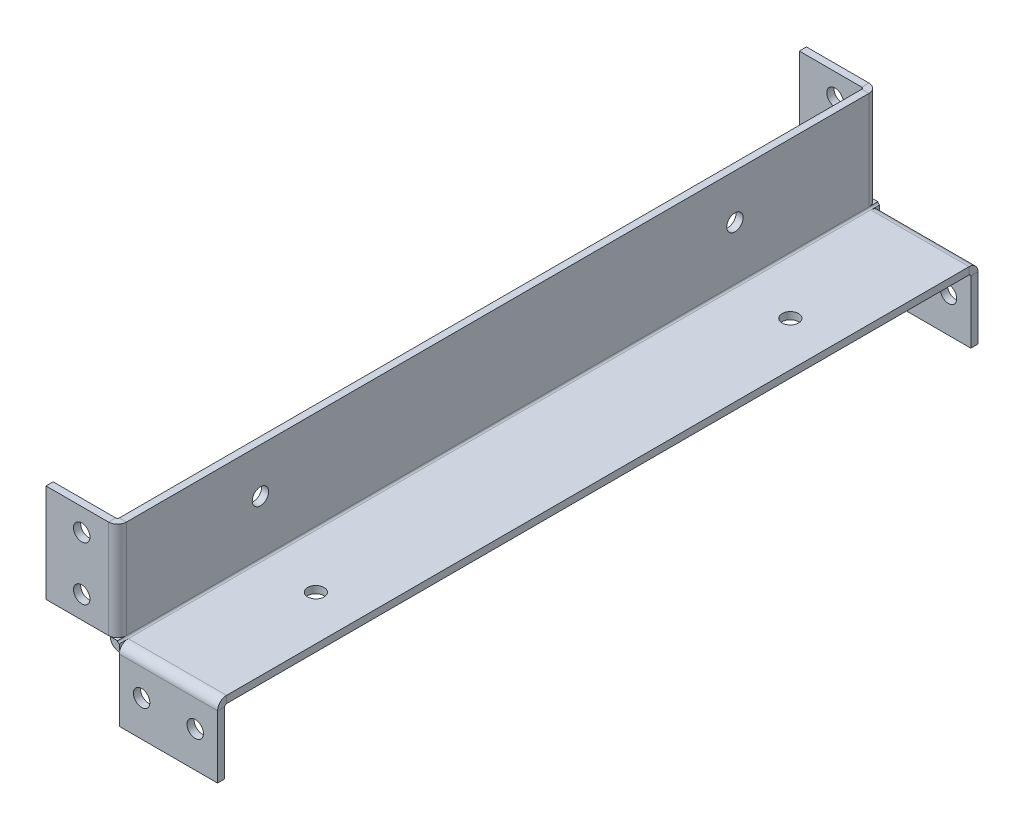
from build123d import *

# Parameters (mm, degrees)
SKETCH1_W                      = 60
SKETCH1_H                      = 425.5
BASE_FLANGE1_DEPTH             = 4
EDGE_FLANGE1_STRIP_W           = 18
EDGE_FLANGE1_STRIP_H           = 4
EDGE_FLANGE1_STRIP_CUT_DEPTH   = 425.5
EDGE_FLANGE1_DEPTH             = 425.5
EDGE_FLANGE2_STRIP_W           = 18
EDGE_FLANGE2_STRIP_H           = 4
EDGE_FLANGE2_STRIP_CUT_DEPTH   = 55
EDGE_FLANGE2_STRIP_2_W         = 18
EDGE_FLANGE2_STRIP_2_H         = 4
EDGE_FLANGE2_STRIP_CUT_2_DEPTH = 55
EDGE_FLANGE2_STRIP_3_W         = 18
EDGE_FLANGE2_STRIP_3_H         = 4
EDGE_FLANGE2_STRIP_CUT_3_DEPTH = 55
EDGE_FLANGE2_STRIP_4_W         = 18
EDGE_FLANGE2_STRIP_4_H         = 4
EDGE_FLANGE2_STRIP_CUT_4_DEPTH = 55
EDGE_FLANGE2_DEPTH             = 55
EDGE_FLANGE2_BEND_DEPTH        = 55
EDGE_FLANGE2_BEND_2_DEPTH      = 55
EDGE_FLANGE2_BEND_3_DEPTH      = 55
SKETCH18_R                     = 4.6
EXTRUDE1_DEPTH                 = 435.748490509
SKETCH19_R                     = 4.6
EXTRUDE2_DEPTH                 = 4
SKETCH20_R                     = 4.6
EXTRUDE3_DEPTH                 = 4


# Sheet-metal steps are written as plain solids
with BuildPart() as part:
    # Sketch1 → Base-Flange1 (new body)
    with BuildSketch(Plane(origin=(0, 0, 0), x_dir=(1, 0, 0), z_dir=(0, 1, 0))):
        Rectangle(SKETCH1_W, SKETCH1_H)
    extrude(amount=BASE_FLANGE1_DEPTH)

    # Edge-Flange1 strip (across the edge) → Edge-Flange1 strip cut (cut)
    with BuildSketch(Plane(origin=(-30, 4, -212.75), x_dir=(1, 0, 0), z_dir=(0, 0, 1))):
        with Locations((-4, -2)):
            Rectangle(EDGE_FLANGE1_STRIP_W, EDGE_FLANGE1_STRIP_H)
    extrude(amount=EDGE_FLANGE1_STRIP_CUT_DEPTH, mode=Mode.SUBTRACT)

    # Edge-Flange1 section (across the edge) → Edge-Flange1 (add)
    with BuildSketch(Plane(origin=(-30, 4, -212.75), x_dir=(1, 0, 0), z_dir=(0, 0, 1))):
        with BuildLine():
            Line((0, 1), (0, 56))
            Line((0, 56), (4, 56))
            Line((4, 56), (4, 1))
            ThreePointArc((4, 1), (4.292893219, 0.292893219), (5, 0))
            Line((5, 0), (5, -4))
            ThreePointArc((5, -4), (1.464466094, -2.535533906), (0, 1))
        make_face()
    extrude(amount=EDGE_FLANGE1_DEPTH)

    # Edge-Flange2 strip (across the edge) → Edge-Flange2 strip cut (cut)
    with BuildSketch(Plane(origin=(-30, 5, 212.75), x_dir=(0, 0, -1), z_dir=(0, 1, 0))):
        with Locations((-4, -2)):
            Rectangle(EDGE_FLANGE2_STRIP_W, EDGE_FLANGE2_STRIP_H)
    extrude(amount=EDGE_FLANGE2_STRIP_CUT_DEPTH, mode=Mode.SUBTRACT)

    # Edge-Flange2 strip 2 (across the edge) → Edge-Flange2 strip cut 2 (cut)
    with BuildSketch(Plane(origin=(30, 0, 212.75), x_dir=(0, 0, -1), z_dir=(-1, 0, 0))):
        with Locations((-4, -2)):
            Rectangle(EDGE_FLANGE2_STRIP_2_W, EDGE_FLANGE2_STRIP_2_H)
    extrude(amount=EDGE_FLANGE2_STRIP_CUT_2_DEPTH, mode=Mode.SUBTRACT)

    # Edge-Flange2 strip 3 (across the edge) → Edge-Flange2 strip cut 3 (cut)
    with BuildSketch(Plane(origin=(-30, 60, -212.75), x_dir=(0, 0, 1), z_dir=(0, -1, 0))):
        with Locations((-4, -2)):
            Rectangle(EDGE_FLANGE2_STRIP_3_W, EDGE_FLANGE2_STRIP_3_H)
    extrude(amount=EDGE_FLANGE2_STRIP_CUT_3_DEPTH, mode=Mode.SUBTRACT)

    # Edge-Flange2 strip 4 (across the edge) → Edge-Flange2 strip cut 4 (cut)
    with BuildSketch(Plane(origin=(-25, 0, -212.75), x_dir=(0, 0, 1), z_dir=(1, 0, 0))):
        with Locations((-4, -2)):
            Rectangle(EDGE_FLANGE2_STRIP_4_W, EDGE_FLANGE2_STRIP_4_H)
    extrude(amount=EDGE_FLANGE2_STRIP_CUT_4_DEPTH, mode=Mode.SUBTRACT)

    # Edge-Flange2 section (across the edge) → Edge-Flange2 (add)
    with BuildSketch(Plane(origin=(-30, 5, 212.75), x_dir=(0, 0, -1), z_dir=(0, 1, 0))):
        with BuildLine():
            Line((0, 1), (0, 36))
            Line((0, 36), (4, 36))
            Line((4, 36), (4, 1))
            ThreePointArc((4, 1), (4.292893219, 0.292893219), (5, 0))
            Line((5, 0), (5, -4))
            ThreePointArc((5, -4), (1.464466094, -2.535533906), (0, 1))
        make_face()
    extrude(amount=EDGE_FLANGE2_DEPTH)

    # Edge-Flange2 section 2 (across the edge) → Edge-Flange2 bend (add)
    with BuildSketch(Plane(origin=(30, 0, 212.75), x_dir=(0, 0, -1), z_dir=(-1, 0, 0))):
        with BuildLine():
            Line((0, 1), (0, 36))
            Line((0, 36), (4, 36))
            Line((4, 36), (4, 1))
            ThreePointArc((4, 1), (4.292893219, 0.292893219), (5, 0))
            Line((5, 0), (5, -4))
            ThreePointArc((5, -4), (1.464466094, -2.535533906), (0, 1))
        make_face()
    extrude(amount=EDGE_FLANGE2_BEND_DEPTH)

    # Edge-Flange2 section 3 (across the edge) → Edge-Flange2 bend 2 (add)
    with BuildSketch(Plane(origin=(-30, 60, -212.75), x_dir=(0, 0, 1), z_dir=(0, -1, 0))):
        with BuildLine():
            Line((0, 1), (0, 36))
            Line((0, 36), (4, 36))
            Line((4, 36), (4, 1))
            ThreePointArc((4, 1), (4.292893219, 0.292893219), (5, 0))
            Line((5, 0), (5, -4))
            ThreePointArc((5, -4), (1.464466094, -2.535533906), (0, 1))
        make_face()
    extrude(amount=EDGE_FLANGE2_BEND_2_DEPTH)

    # Edge-Flange2 section 4 (across the edge) → Edge-Flange2 bend 3 (add)
    with BuildSketch(Plane(origin=(-25, 0, -212.75), x_dir=(0, 0, 1), z_dir=(1, 0, 0))):
        with BuildLine():
            Line((0, 1), (0, 36))
            Line((0, 36), (4, 36))
            Line((4, 36), (4, 1))
            ThreePointArc((4, 1), (4.292893219, 0.292893219), (5, 0))
            Line((5, 0), (5, -4))
            ThreePointArc((5, -4), (1.464466094, -2.535533906), (0, 1))
        make_face()
    extrude(amount=EDGE_FLANGE2_BEND_3_DEPTH)

    # Sketch18 → Extrude1 (cut, through all)
    with BuildSketch(Plane.XY.offset(212.75)):
        with Locations((-46, 47.5)):
            Circle(SKETCH18_R)
        with Locations((-46, 17.5)):
            Circle(SKETCH18_R)
        with Locations((-12.5, -16)):
            Circle(SKETCH18_R)
        with Locations((17.5, -16)):
            Circle(SKETCH18_R)
    extrude(amount=-EXTRUDE1_DEPTH, mode=Mode.SUBTRACT)

    # Sketch19 → Extrude2 (cut)
    with BuildSketch(Plane(origin=(-26, 0, 0), x_dir=(0, 0, -1), z_dir=(1, 0, 0))):
        with Locations(Location((-132.75, 35, 0), (0, 0, 90))):
            Circle(SKETCH19_R)
        with Locations(Location((132.75, 35, 0), (0, 0, 90))):
            Circle(SKETCH19_R)
    extrude(amount=-EXTRUDE2_DEPTH, mode=Mode.SUBTRACT)

    # Sketch20 → Extrude3 (cut)
    with BuildSketch(Plane(origin=(0, 4, 0), x_dir=(1, 0, 0), z_dir=(0, 1, 0))):
        with Locations(Location((5, 132.75, 0), (0, 0, 270))):
            Circle(SKETCH20_R)
        with Locations(Location((5, -132.75, 0), (0, 0, 270))):
            Circle(SKETCH20_R)
    extrude(amount=-EXTRUDE3_DEPTH, mode=Mode.SUBTRACT)


solid = part.part
